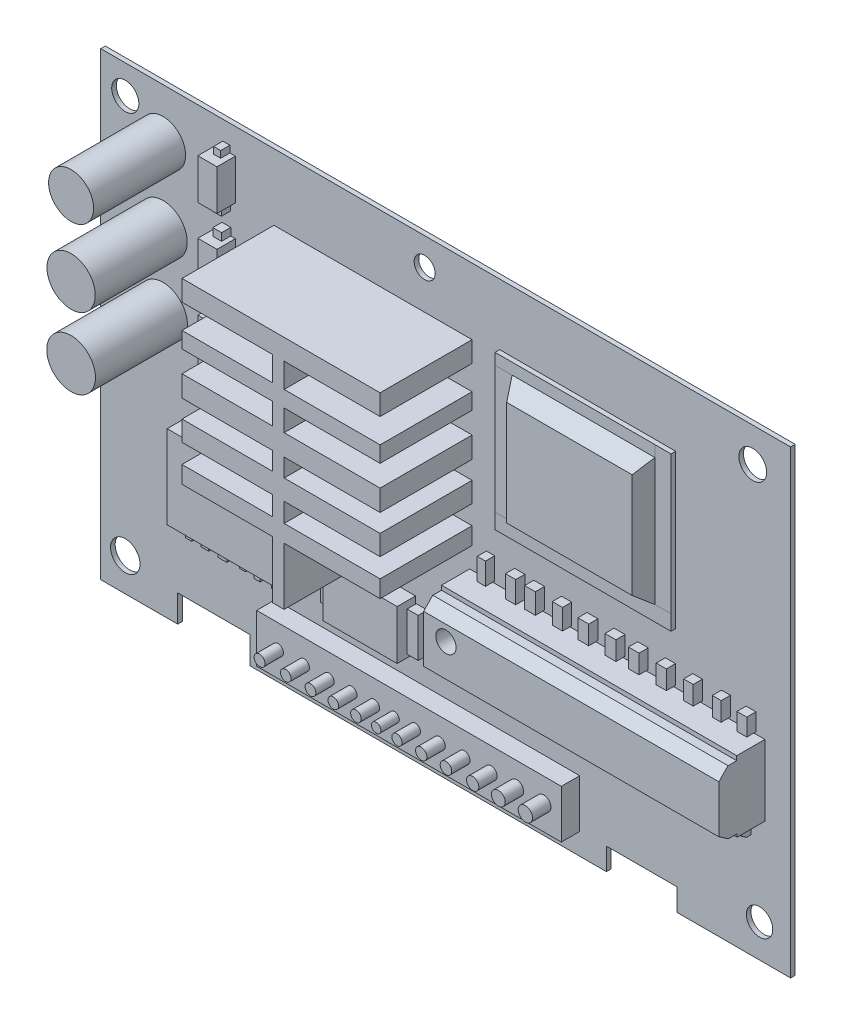
from build123d import *

# Parameters (mm, degrees)
SKETCH1_W            = 150
SKETCH1_H            = 100
BASE_FLANGE1_DEPTH   = 1
BOSS_EXTRUDE1_DEPTH  = 20
SKETCH7_W            = 38.251618342
SKETCH7_H            = 33.405476622
BOSS_EXTRUDE2_DEPTH  = 1
SKETCH20_R           = 4.893913718
SKETCH20_R_2         = 5.251573259
SKETCH20_R_3         = 5.291818848
BOSS_EXTRUDE6_DEPTH  = 20
SKETCH24_W           = 64.192317237
SKETCH24_H           = 15.400590588
BOSS_EXTRUDE8_DEPTH  = 10
CUT_EXTRUDE30_DEPTH  = 155.125892119
CUT_EXTRUDE31_DEPTH  = 70
SKETCH28_W           = 1.829521506
SKETCH28_H           = 1.981017468
CUT_EXTRUDE33_DEPTH  = 155.125892119
SKETCH29_W           = 1.913952811
SKETCH29_H           = 1.907943991
CUT_EXTRUDE34_DEPTH  = 70
SKETCH30_R           = 2.208258319
CUT_EXTRUDE35_DEPTH  = 4
SKETCH31_W           = 15.773922064
SKETCH31_H           = 7.980883473
CUT_EXTRUDE36_DEPTH  = 4
SKETCH32_W           = 15.316742759
SKETCH32_H           = 7.752912661
CUT_EXTRUDE37_DEPTH  = 4
SKETCH33_R           = 3.026227229
CUT_EXTRUDE38_DEPTH  = 4
SKETCH34_R           = 2.94966091
SKETCH34_R_2         = 3.19837787
SKETCH34_R_3         = 2.871285426
CUT_EXTRUDE39_DEPTH  = 4
SKETCH35_W           = 25.995297727
SKETCH35_H           = 18.101056575
BOSS_EXTRUDE9_DEPTH  = 4
SKETCH36_W           = 66.247990623
SKETCH36_H           = 10.503055181
BOSS_EXTRUDE10_DEPTH = 4
SKETCH37_R           = 1.181265196
SKETCH37_R_2         = 1.148680325
SKETCH37_R_3         = 1.160826502
SKETCH37_R_4         = 1.147015866
SKETCH37_R_5         = 1.033782863
SKETCH37_R_6         = 1.118734734
SKETCH37_R_7         = 1.234131395
SKETCH37_R_8         = 1.248812987
SKETCH37_R_9         = 1.327543916
SKETCH37_R_10        = 1.495383113
SKETCH37_R_11        = 1.557211208
BOSS_EXTRUDE11_DEPTH = 4
SKETCH38_R           = 2.284411124
CUT_EXTRUDE40_DEPTH  = 4
SKETCH41_W           = 1.375715726
SKETCH41_H           = 2.451416596
BOSS_EXTRUDE12_DEPTH = 2
SKETCH42_W           = 1.626401118
SKETCH42_H           = 2.461788857
BOSS_EXTRUDE13_DEPTH = 2
SKETCH43_W           = 1.958242371
SKETCH43_H           = 2.595832426
BOSS_EXTRUDE14_DEPTH = 2
SKETCH44_W           = 1.307161781
SKETCH44_H           = 3.440066665
BOSS_EXTRUDE15_DEPTH = 2
SKETCH45_W           = 1.379680109
SKETCH45_H           = 3.07138269
BOSS_EXTRUDE16_DEPTH = 2
SKETCH46_W           = 1.229332724
SKETCH46_H           = 3.115343909
BOSS_EXTRUDE17_DEPTH = 2
SKETCH47_W           = 1.427413705
SKETCH47_H           = 2.291843062
BOSS_EXTRUDE18_DEPTH = 2
SKETCH48_W           = 1.293247009
SKETCH48_H           = 2.149750627
BOSS_EXTRUDE19_DEPTH = 2
SKETCH49_W           = 1.181554162
SKETCH49_H           = 2.147356577
BOSS_EXTRUDE20_DEPTH = 2
SKETCH50_W           = 1.044464477
SKETCH50_H           = 2.065160328
BOSS_EXTRUDE21_DEPTH = 2
SKETCH51_W           = 1.029224977
SKETCH51_H           = 2.03555594
BOSS_EXTRUDE22_DEPTH = 2
SKETCH52_W           = 1.229200506
SKETCH52_H           = 1.921496808
BOSS_EXTRUDE24_DEPTH = 2
SKETCH53_W           = 1.112480255
SKETCH53_H           = 1.939294632
BOSS_EXTRUDE25_DEPTH = 2
SKETCH54_W           = 1.460651109
SKETCH54_H           = 1.9628929
BOSS_EXTRUDE26_DEPTH = 2
SKETCH55_W           = 2.862023797
SKETCH55_H           = 4.090480276
BOSS_EXTRUDE27_DEPTH = 2
SKETCH56_W           = 2.013853896
SKETCH56_H           = 4.191456529
SKETCH56_W_2         = 2.414065377
SKETCH56_W_3         = 2.03515958
SKETCH56_W_4         = 2.075413009
SKETCH56_W_5         = 2.49735471
SKETCH56_W_6         = 2.201159214
SKETCH56_H_2         = 4.020421204
SKETCH56_W_7         = 2.258671053
SKETCH56_W_8         = 2.935957611
SKETCH56_W_9         = 2.233644039
SKETCH56_W_10        = 2.248145216
BOSS_EXTRUDE28_DEPTH = 2
SKETCH57_W           = 2.145937785
SKETCH57_H           = 3.766112071
SKETCH57_W_2         = 1.928839135
SKETCH57_H_2         = 4.09164846
SKETCH57_W_3         = 2.091540081
SKETCH57_W_4         = 2.21160144
SKETCH57_W_5         = 2.308978198
SKETCH57_W_6         = 2.389169442
SKETCH57_W_7         = 2.368555189
SKETCH57_W_8         = 2.225421976
SKETCH57_H_3         = 4.453812364
SKETCH57_W_9         = 2.327276879
SKETCH57_W_10        = 2.233921941
SKETCH57_H_4         = 4.761879491
SKETCH57_W_11        = 1.792325782
SKETCH57_H_5         = 4.770248678
BOSS_EXTRUDE29_DEPTH = 2
SKETCH58_W           = 3.061349205
SKETCH58_H           = 1.907791472
SKETCH58_W_2         = 1.986025538
SKETCH58_H_2         = 2.155402711
SKETCH58_W_3         = 2.334649661
SKETCH58_W_4         = 2.149597386
SKETCH58_W_5         = 2.057874793
SKETCH58_W_6         = 2.49493272
SKETCH58_W_7         = 2.221617764
SKETCH58_H_3         = 1.916423675
SKETCH58_W_8         = 2.234745779
SKETCH58_H_4         = 2.236082286
SKETCH58_W_9         = 2.968185876
SKETCH58_H_5         = 2.280175952
SKETCH58_W_10        = 2.22983103
SKETCH58_W_11        = 2.240524801
BOSS_EXTRUDE30_DEPTH = 2
CUT_EXTRUDE42_DEPTH  = 70
CUT_EXTRUDE43_DEPTH  = 70
SKETCH62_W           = 16.149656918
SKETCH62_H           = 10.730261251
BOSS_EXTRUDE31_DEPTH = 4
SKETCH63_W           = 4.162884384
SKETCH63_H           = 8.812013171
SKETCH63_H_2         = 9.491073275
SKETCH63_H_3         = 9.653694527
BOSS_EXTRUDE32_DEPTH = 4
SKETCH64_W           = 1.82396348
SKETCH64_H           = 2.286507606
SKETCH64_W_2         = 1.584314373
SKETCH64_H_2         = 1.452145851
SKETCH64_W_3         = 1.542977073
SKETCH64_H_3         = 1.110525837
SKETCH64_W_4         = 1.911962543
SKETCH64_H_4         = 1.637025818
SKETCH64_W_5         = 1.724683831
SKETCH64_H_5         = 1.418797602
SKETCH64_W_6         = 1.547170171
SKETCH64_H_6         = 1.462342792
BOSS_EXTRUDE33_DEPTH = 2
SKETCH65_W           = 2.41426032
SKETCH65_H           = 8.495336877
SKETCH65_W_2         = 2.52605134
SKETCH65_H_2         = 8.055999216
BOSS_EXTRUDE34_DEPTH = 2
SKETCH8_W            = 30.996510459
SKETCH8_H            = 27.675141165
BOSS_EXTRUDE36_DEPTH = 3
CUT_EXTRUDE45_DEPTH  = 40
CUT_EXTRUDE46_DEPTH  = 40
CUT_EXTRUDE48_DEPTH  = 40
CUT_EXTRUDE50_DEPTH  = 40


# Sheet-metal steps are written as plain solids
with BuildPart() as part:
    # Sketch1 → Base-Flange1 (new body)
    with BuildSketch(Plane.XY):
        Rectangle(SKETCH1_W, SKETCH1_H)
    extrude(amount=-BASE_FLANGE1_DEPTH)

    # Sketch6 → Boss-Extrude1 (add)
    with BuildSketch(Plane.XY):
        Polygon((-17.647750579, 31.094193667), (-17.647750579, 25.768885259), (-37.3337456, 25.768885259), (-37.3337456, 22.28272734), (-17.647750579, 22.28272734), (-17.647750579, 17.622101617), (-37.3337456, 17.622101617), (-37.3337456, 13.026910723), (-17.647750579, 13.026910723), (-17.647750579, 9.091734312), (-37.3337456, 9.091734312), (-37.3337456, 4.705010118), (-17.647750579, 4.705010118), (-17.647750579, 0.536354704), (-37.3337456, 0.536354704), (-37.3337456, -3.191619653), (-17.647750579, -3.191619653), (-17.647750579, -15.655678223), (-15.115535007, -15.655678223), (-15.115535007, -3.191619653), (5.742253828, -3.191619653), (5.742253828, 0.536354704), (-15.115535007, 0.536354704), (-15.115535007, 4.705010118), (5.742253828, 4.705010118), (5.742253828, 9.091734312), (-15.115535007, 9.091734312), (-15.115535007, 13.026910723), (5.742253828, 13.026910723), (5.742253828, 17.622101617), (-15.115535007, 17.622101617), (-15.115535007, 22.28272734), (5.742253828, 22.28272734), (5.742253828, 25.768885259), (-15.115535007, 25.768885259), (-15.115535007, 31.094193667), (5.742253828, 31.094193667), (5.742253828, 35.571913058), (-37.3337456, 35.571913058), (-37.3337456, 31.094193667), align=None)
    extrude(amount=BOSS_EXTRUDE1_DEPTH)

    # Sketch7 → Boss-Extrude2 (add)
    with BuildSketch(Plane.XY):
        with Locations((30.876301757, 19.988298592)):
            Rectangle(SKETCH7_W, SKETCH7_H)
    extrude(amount=BOSS_EXTRUDE2_DEPTH)

    # Sketch20 → Boss-Extrude6 (add)
    with BuildSketch(Plane.XY):
        with Locations((-61.445747498, 39.123272928)):
            Circle(SKETCH20_R)
        with Locations((-61.445747498, 22.944365114)):
            Circle(SKETCH20_R_2)
        with Locations((-61.445747498, 7.478393427)):
            Circle(SKETCH20_R_3)
    extrude(amount=BOSS_EXTRUDE6_DEPTH)

    # Sketch24 → Boss-Extrude8 (add)
    with BuildSketch(Plane.XY):
        with Locations((37.315719775, -15.564442532)):
            Rectangle(SKETCH24_W, SKETCH24_H)
    extrude(amount=BOSS_EXTRUDE8_DEPTH)

    # Sketch25 → Cut-Extrude30 (cut, through all)
    with BuildSketch(Plane(origin=(69.411878394, 0, 0), x_dir=(0, 0, -1), z_dir=(1, 0, 0))):
        Polygon((-6.95948185, -23.264737826), (-10, -21.210215597), (-10.383799283, -21.210215597), (-13.173179255, -25.338260702), align=None)
    extrude(amount=-CUT_EXTRUDE30_DEPTH, mode=Mode.SUBTRACT)

    # Sketch26 → Cut-Extrude31 (cut)
    with BuildSketch(Plane(origin=(69.411878394, 0, 0), x_dir=(0, 0, -1), z_dir=(1, 0, 0))):
        Polygon((-7.157587152, -7.864147238), (-10, -10.846715803), (-12.149574274, -7.378868006), align=None)
    extrude(amount=-CUT_EXTRUDE31_DEPTH, mode=Mode.SUBTRACT)

    # Sketch28 → Cut-Extrude33 (cut, through all)
    with BuildSketch(Plane(origin=(69.411878394, 0, 0), x_dir=(0, 0, -1), z_dir=(1, 0, 0))):
        with Locations((-6.95948185, -23.596243063)):
            Rectangle(SKETCH28_W, SKETCH28_H)
    extrude(amount=-CUT_EXTRUDE33_DEPTH, mode=Mode.SUBTRACT)

    # Sketch29 → Cut-Extrude34 (cut)
    with BuildSketch(Plane(origin=(69.411878394, 0, 0), x_dir=(0, 0, -1), z_dir=(1, 0, 0))):
        with Locations((-7.07856122, -7.864147238)):
            Rectangle(SKETCH29_W, SKETCH29_H)
    extrude(amount=-CUT_EXTRUDE34_DEPTH, mode=Mode.SUBTRACT)

    # Sketch30 → Cut-Extrude35 (cut)
    with BuildSketch(Plane.XY.offset(10)):
        with Locations((10.059798535, -14.15654171)):
            Circle(SKETCH30_R)
    extrude(amount=-CUT_EXTRUDE35_DEPTH, mode=Mode.SUBTRACT)

    # Sketch31 → Cut-Extrude36 (cut)
    with BuildSketch(Plane.XY):
        with Locations((-50.382765947, -48.096382801)):
            Rectangle(SKETCH31_W, SKETCH31_H)
    extrude(amount=-CUT_EXTRUDE36_DEPTH, mode=Mode.SUBTRACT)

    # Sketch32 → Cut-Extrude37 (cut)
    with BuildSketch(Plane.XY):
        with Locations((42.623404519, -49.055562996)):
            Rectangle(SKETCH32_W, SKETCH32_H)
    extrude(amount=-CUT_EXTRUDE37_DEPTH, mode=Mode.SUBTRACT)

    # Sketch33 → Cut-Extrude38 (cut)
    with BuildSketch(Plane.XY):
        with Locations((66.770748421, 42.592540068)):
            Circle(SKETCH33_R)
    extrude(amount=-CUT_EXTRUDE38_DEPTH, mode=Mode.SUBTRACT)

    # Sketch34 → Cut-Extrude39 (cut)
    with BuildSketch(Plane.XY):
        with Locations((-69.666143344, 43.767302707)):
            Circle(SKETCH34_R)
        with Locations((-69.666143344, -42.810509177)):
            Circle(SKETCH34_R_2)
        with Locations((68.245145494, -42.810509177)):
            Circle(SKETCH34_R_3)
    extrude(amount=-CUT_EXTRUDE39_DEPTH, mode=Mode.SUBTRACT)

    # Sketch35 → Boss-Extrude9 (add)
    with BuildSketch(Plane.XY):
        with Locations((-43.558798458, -19.388431916)):
            Rectangle(SKETCH35_W, SKETCH35_H)
    extrude(amount=BOSS_EXTRUDE9_DEPTH)

    # Sketch36 → Boss-Extrude10 (add)
    with BuildSketch(Plane.XY):
        with Locations((-3.980345024, -40.083616171)):
            Rectangle(SKETCH36_W, SKETCH36_H)
    extrude(amount=BOSS_EXTRUDE10_DEPTH)

    # Sketch37 → Boss-Extrude11 (add)
    with BuildSketch(Plane.XY.offset(4)):
        with Locations((-32.461773453, -39.922141762)):
            Circle(SKETCH37_R)
        with Locations((-26.768920114, -39.922141762)):
            Circle(SKETCH37_R_2)
        with Locations((-21.391562505, -39.922141762)):
            Circle(SKETCH37_R_3)
        with Locations((-16.432461651, -39.922141762)):
            Circle(SKETCH37_R_4)
        with Locations((-11.514578285, -39.922141762)):
            Circle(SKETCH37_R_4)
        with Locations((-7.111969395, -39.922141762)):
            Circle(SKETCH37_R_5)
        with Locations((-2.592262692, -39.922141762)):
            Circle(SKETCH37_R_6)
        with Locations((2.686057552, -39.922141762)):
            Circle(SKETCH37_R_7)
        with Locations((8.058652609, -39.922141762)):
            Circle(SKETCH37_R_8)
        with Locations((13.87803858, -39.922141762)):
            Circle(SKETCH37_R_9)
        with Locations((19.454436288, -39.922141762)):
            Circle(SKETCH37_R_10)
        with Locations((25.32464073, -39.922141762)):
            Circle(SKETCH37_R_11)
    extrude(amount=BOSS_EXTRUDE11_DEPTH)

    # Sketch38 → Cut-Extrude40 (cut)
    with BuildSketch(Plane.XY):
        with Locations((-4.570119234, 44.001544941)):
            Circle(SKETCH38_R)
    extrude(amount=-CUT_EXTRUDE40_DEPTH, mode=Mode.SUBTRACT)

    # Sketch41 → Boss-Extrude12 (add)
    with BuildSketch(Plane(origin=(0, -28.438960203, 0), x_dir=(-1, 0, 0), z_dir=(0, -1, 0))):
        with Locations((53.441447581, -1.225708298)):
            Rectangle(SKETCH41_W, SKETCH41_H)
    extrude(amount=BOSS_EXTRUDE12_DEPTH)

    # Sketch42 → Boss-Extrude13 (add)
    with BuildSketch(Plane(origin=(0, -28.438960203, 0), x_dir=(-1, 0, 0), z_dir=(0, -1, 0))):
        with Locations((49.882089405, -1.230894429)):
            Rectangle(SKETCH42_W, SKETCH42_H)
    extrude(amount=BOSS_EXTRUDE13_DEPTH)

    # Sketch43 → Boss-Extrude14 (add)
    with BuildSketch(Plane(origin=(0, -28.438960203, 0), x_dir=(-1, 0, 0), z_dir=(0, -1, 0))):
        with Locations((45.973423436, -1.297916213)):
            Rectangle(SKETCH43_W, SKETCH43_H)
    extrude(amount=BOSS_EXTRUDE14_DEPTH)

    # Sketch44 → Boss-Extrude15 (add)
    with BuildSketch(Plane(origin=(0, -28.438960203, 0), x_dir=(-1, 0, 0), z_dir=(0, -1, 0))):
        with Locations((41.827286179, -0.628457698)):
            Rectangle(SKETCH44_W, SKETCH44_H)
    extrude(amount=BOSS_EXTRUDE15_DEPTH)

    # Sketch45 → Boss-Extrude16 (add)
    with BuildSketch(Plane(origin=(0, -28.438960203, 0), x_dir=(-1, 0, 0), z_dir=(0, -1, 0))):
        with Locations((38.372398816, -1.129560262)):
            Rectangle(SKETCH45_W, SKETCH45_H)
    extrude(amount=BOSS_EXTRUDE16_DEPTH)

    # Sketch46 → Boss-Extrude17 (add)
    with BuildSketch(Plane(origin=(0, -28.438960203, 0), x_dir=(-1, 0, 0), z_dir=(0, -1, 0))):
        with Locations((34.656178331, -1.024237824)):
            Rectangle(SKETCH46_W, SKETCH46_H)
    extrude(amount=BOSS_EXTRUDE17_DEPTH)

    # Sketch47 → Boss-Extrude18 (add)
    with BuildSketch(Plane(origin=(0, -10.337903628, 0), x_dir=(1, 0, 0), z_dir=(0, 1, 0))):
        with Locations((-53.086628292, -1.145921531)):
            Rectangle(SKETCH47_W, SKETCH47_H)
    extrude(amount=BOSS_EXTRUDE18_DEPTH)

    # Sketch48 → Boss-Extrude19 (add)
    with BuildSketch(Plane(origin=(0, -10.337903628, 0), x_dir=(1, 0, 0), z_dir=(0, 1, 0))):
        with Locations((-49.855259062, -1.074875313)):
            Rectangle(SKETCH48_W, SKETCH48_H)
    extrude(amount=BOSS_EXTRUDE19_DEPTH)

    # Sketch49 → Boss-Extrude20 (add)
    with BuildSketch(Plane(origin=(0, -10.337903628, 0), x_dir=(1, 0, 0), z_dir=(0, 1, 0))):
        with Locations((-46.61660723, -1.073678289)):
            Rectangle(SKETCH49_W, SKETCH49_H)
    extrude(amount=BOSS_EXTRUDE20_DEPTH)

    # Sketch50 → Boss-Extrude21 (add)
    with BuildSketch(Plane(origin=(0, -10.337903628, 0), x_dir=(1, 0, 0), z_dir=(0, 1, 0))):
        with Locations((-43.679284061, -0.887375897)):
            Rectangle(SKETCH50_W, SKETCH50_H)
    extrude(amount=BOSS_EXTRUDE21_DEPTH)

    # Sketch51 → Boss-Extrude22 (add)
    with BuildSketch(Plane(origin=(0, -10.337903628, 0), x_dir=(1, 0, 0), z_dir=(0, 1, 0))):
        with Locations((-41.085941594, -0.915066637)):
            Rectangle(SKETCH51_W, SKETCH51_H)
    extrude(amount=BOSS_EXTRUDE22_DEPTH)

    # Sketch52 → Boss-Extrude24 (add)
    with BuildSketch(Plane.XY):
        with Locations((-38.491139911, -9.334604882)):
            Rectangle(SKETCH52_W, SKETCH52_H)
    extrude(amount=BOSS_EXTRUDE24_DEPTH)

    # Sketch53 → Boss-Extrude25 (add)
    with BuildSketch(Plane.XY):
        with Locations((-35.985401094, -9.471766755)):
            Rectangle(SKETCH53_W, SKETCH53_H)
    extrude(amount=BOSS_EXTRUDE25_DEPTH)

    # Sketch54 → Boss-Extrude26 (add)
    with BuildSketch(Plane.XY):
        with Locations((-32.796721328, -9.424908257)):
            Rectangle(SKETCH54_W, SKETCH54_H)
    extrude(amount=BOSS_EXTRUDE26_DEPTH)

    # Sketch55 → Boss-Extrude27 (add)
    with BuildSketch(Plane.XY):
        with Locations((9.4679968, -25.439262963)):
            Rectangle(SKETCH55_W, SKETCH55_H)
    extrude(amount=BOSS_EXTRUDE27_DEPTH)

    # Sketch56 → Boss-Extrude28 (add)
    with BuildSketch(Plane.XY):
        with Locations((15.930871519, -25.052037167)):
            Rectangle(SKETCH56_W, SKETCH56_H)
        with Locations((21.299661032, -25.052037167)):
            Rectangle(SKETCH56_W_2, SKETCH56_H)
        with Locations((26.145432754, -25.052037167)):
            Rectangle(SKETCH56_W_3, SKETCH56_H)
        with Locations((31.479211629, -25.052037167)):
            Rectangle(SKETCH56_W_4, SKETCH56_H)
        with Locations((36.292401806, -25.052037167)):
            Rectangle(SKETCH56_W_5, SKETCH56_H)
        with Locations((41.623450192, -25.329015551)):
            Rectangle(SKETCH56_W_6, SKETCH56_H_2)
        with Locations((47.47250203, -25.329015551)):
            Rectangle(SKETCH56_W_7, SKETCH56_H_2)
        with Locations((53.595229455, -25.329015551)):
            Rectangle(SKETCH56_W_8, SKETCH56_H_2)
        with Locations((59.694041926, -25.329015551)):
            Rectangle(SKETCH56_W_9, SKETCH56_H_2)
        with Locations((65.248987414, -25.329015551)):
            Rectangle(SKETCH56_W_10, SKETCH56_H_2)
    extrude(amount=BOSS_EXTRUDE28_DEPTH)

    # Sketch57 → Boss-Extrude29 (add)
    with BuildSketch(Plane.XY):
        with Locations((66.399242935, -5.520789868)):
            Rectangle(SKETCH57_W, SKETCH57_H)
        with Locations((60.943696913, -5.351478881)):
            Rectangle(SKETCH57_W_2, SKETCH57_H_2)
        with Locations((54.785557878, -5.351478881)):
            Rectangle(SKETCH57_W_3, SKETCH57_H_2)
        with Locations((48.883573918, -5.351478881)):
            Rectangle(SKETCH57_W_4, SKETCH57_H_2)
        with Locations((42.889723965, -5.351478881)):
            Rectangle(SKETCH57_W_5, SKETCH57_H_2)
        with Locations((37.826934409, -5.351478881)):
            Rectangle(SKETCH57_W_6, SKETCH57_H_2)
        with Locations((31.917946403, -5.351478881)):
            Rectangle(SKETCH57_W_7, SKETCH57_H_2)
        with Locations((26.295878957, -5.242532258)):
            Rectangle(SKETCH57_W_8, SKETCH57_H_3)
        with Locations((20.333553309, -5.242532258)):
            Rectangle(SKETCH57_W_9, SKETCH57_H_3)
        with Locations((16.106794882, -5.242532259)):
            Rectangle(SKETCH57_W_10, SKETCH57_H_4)
        with Locations((9.759089575, -5.04990077)):
            Rectangle(SKETCH57_W_11, SKETCH57_H_5)
    extrude(amount=BOSS_EXTRUDE29_DEPTH)

    # Sketch58 → Boss-Extrude30 (add)
    with BuildSketch(Plane.XY.offset(2)):
        with Locations((9.368334096, -24.287447968)):
            Rectangle(SKETCH58_W, SKETCH58_H)
        with Locations((15.935025298, -24.361561608)):
            Rectangle(SKETCH58_W_2, SKETCH58_H_2)
        with Locations((21.316704376, -24.361561608)):
            Rectangle(SKETCH58_W_3, SKETCH58_H_2)
        with Locations((26.088213851, -24.361561608)):
            Rectangle(SKETCH58_W_4, SKETCH58_H_2)
        with Locations((31.498824348, -24.361561608)):
            Rectangle(SKETCH58_W_5, SKETCH58_H_2)
        with Locations((36.293612801, -24.361561608)):
            Rectangle(SKETCH58_W_6, SKETCH58_H_2)
        with Locations((41.640508169, -24.32122182)):
            Rectangle(SKETCH58_W_7, SKETCH58_H_3)
        with Locations((47.484464667, -24.32122182)):
            Rectangle(SKETCH58_W_8, SKETCH58_H_4)
        with Locations((53.579115322, -24.504832935)):
            Rectangle(SKETCH58_W_9, SKETCH58_H_5)
        with Locations((59.69594843, -24.504832935)):
            Rectangle(SKETCH58_W_10, SKETCH58_H_5)
        with Locations((65.248383795, -24.504832935)):
            Rectangle(SKETCH58_W_11, SKETCH58_H_5)
    extrude(amount=BOSS_EXTRUDE30_DEPTH)

    # Sketch59 → Cut-Extrude42 (cut)
    with BuildSketch(Plane(origin=(66.368646195, 0, 0), x_dir=(0, 0, -1), z_dir=(1, 0, 0))):
        Polygon((-3.167794698, -25.644920911), (-4.471121941, -24.30317603), (-5.017719762, -26.218189345), align=None)
    extrude(amount=-CUT_EXTRUDE42_DEPTH, mode=Mode.SUBTRACT)

    # Sketch60 → Cut-Extrude43 (cut)
    with BuildSketch(Plane(origin=(66.373060022, 0, 0), x_dir=(0, 0, -1), z_dir=(1, 0, 0))):
        Polygon((-1, -27.339226153), (-2.440588327, -26.329263207), (-3.771198576, -27.550219069), (-3.51386615, -28.551200696), align=None)
    extrude(amount=-CUT_EXTRUDE43_DEPTH, mode=Mode.SUBTRACT)

    # Sketch62 → Boss-Extrude31 (add)
    with BuildSketch(Plane.XY):
        with Locations((-14.622272799, -24.190447402)):
            Rectangle(SKETCH62_W, SKETCH62_H)
    extrude(amount=BOSS_EXTRUDE31_DEPTH)

    # Sketch63 → Boss-Extrude32 (add)
    with BuildSketch(Plane.XY):
        with Locations((-47.807181002, 39.992576914)):
            Rectangle(SKETCH63_W, SKETCH63_H)
        with Locations((-47.807181002, 24.105594053)):
            Rectangle(SKETCH63_W, SKETCH63_H_2)
        with Locations((-47.807181002, 9.560017977)):
            Rectangle(SKETCH63_W, SKETCH63_H_3)
    extrude(amount=BOSS_EXTRUDE32_DEPTH)

    # Sketch64 → Boss-Extrude33 (add)
    with BuildSketch(Plane.XY):
        with Locations((-47.69029113, 2.967706586)):
            Rectangle(SKETCH64_W, SKETCH64_H)
        with Locations((-47.697382873, 15.112938167)):
            Rectangle(SKETCH64_W_2, SKETCH64_H_2)
        with Locations((-47.718051523, 18.170612557)):
            Rectangle(SKETCH64_W_3, SKETCH64_H_3)
        with Locations((-47.67958854, 29.669643599)):
            Rectangle(SKETCH64_W_4, SKETCH64_H_4)
        with Locations((-47.627198144, 34.258779813)):
            Rectangle(SKETCH64_W_5, SKETCH64_H_5)
        with Locations((-47.68892671, 45.129754895)):
            Rectangle(SKETCH64_W_6, SKETCH64_H_6)
    extrude(amount=BOSS_EXTRUDE33_DEPTH)

    # Sketch65 → Boss-Extrude34 (add)
    with BuildSketch(Plane.XY):
        with Locations((-5.186216329, -24.464382883)):
            Rectangle(SKETCH65_W, SKETCH65_H)
        with Locations((-23.922749004, -24.333427924)):
            Rectangle(SKETCH65_W_2, SKETCH65_H_2)
    extrude(amount=BOSS_EXTRUDE34_DEPTH)

    # Sketch8 → Boss-Extrude36 (add)
    with BuildSketch(Plane.XY.offset(1)):
        with Locations((31.012732639, 20.418844431)):
            Rectangle(SKETCH8_W, SKETCH8_H)
    extrude(amount=BOSS_EXTRUDE36_DEPTH)

    # Sketch72 → Cut-Extrude45 (cut)
    with BuildSketch(Plane(origin=(46.510987868, 0, 0), x_dir=(0, 0, -1), z_dir=(1, 0, 0))):
        Polygon((-4, 31.530886191), (-1, 34.256415013), (-4.945790408, 35.585741459), align=None)
    extrude(amount=-CUT_EXTRUDE45_DEPTH, mode=Mode.SUBTRACT)

    # Sketch73 → Cut-Extrude46 (cut)
    with BuildSketch(Plane(origin=(0, 6.581273848, 0), x_dir=(-1, 0, 0), z_dir=(0, -1, 0))):
        Polygon((-15.514477409, -1.110503972), (-17.778151425, -4.856238075), (-12.911077218, -5.38954298), align=None)
    extrude(amount=-CUT_EXTRUDE46_DEPTH, mode=Mode.SUBTRACT)

    # Sketch74 → Cut-Extrude48 (cut)
    with BuildSketch(Plane(origin=(0, 6.581273848, 0), x_dir=(-1, 0, 0), z_dir=(0, -1, 0))):
        Polygon((-46.510987868, -1), (-44.021403155, -4.779249321), (-47.858197998, -5.394597483), align=None)
    extrude(amount=-CUT_EXTRUDE48_DEPTH, mode=Mode.SUBTRACT)

    # Sketch76 → Cut-Extrude50 (cut)
    with BuildSketch(Plane(origin=(50.002110928, 0, 0), x_dir=(0, 0, -1), z_dir=(1, 0, 0))):
        Polygon((-1, 6.580298979), (-7.367230248, 11.297984555), (-7.498473278, 2.861320449), align=None)
    extrude(amount=-CUT_EXTRUDE50_DEPTH, mode=Mode.SUBTRACT)


solid = part.part
